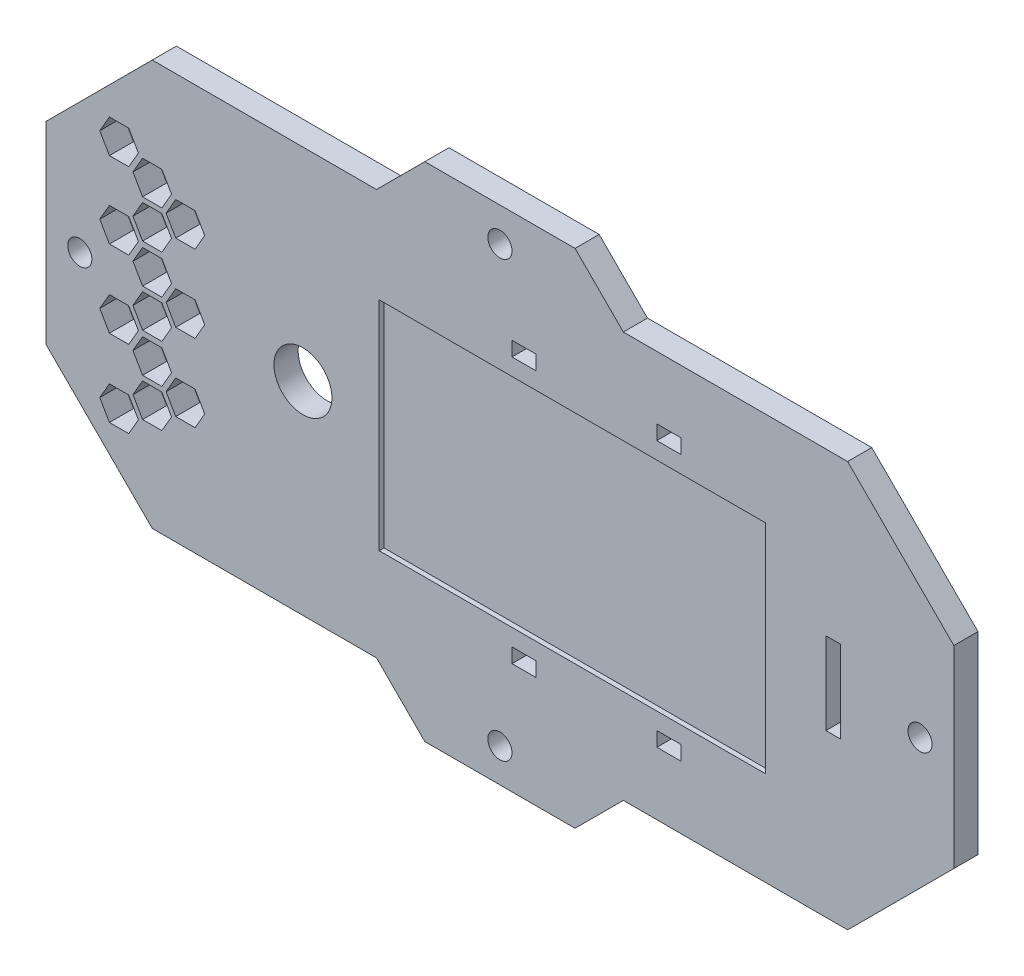
from build123d import *

# Parameters (mm, degrees)
BASE_FLANGE1_OUTLINE_R  = 6
BASE_FLANGE1_DEPTH      = 5
SKETCH3_W               = 80
SKETCH3_H               = 45
CUT_EXTRUDE1_DEPTH      = 1
CROQUIS1_W              = 5
CROQUIS1_H              = 3
CORTAR_EXTRUIR1_DEPTH   = 108.540687679
CROQUIS2_R              = 2.5
CORTAR_EXTRUIR2_DEPTH   = 108.540687679
CROQUIS3_R              = 2.5
SALIENTE_EXTRUIR1_DEPTH = 5
CUT_EXTRUDE3_DEPTH      = 10
SKETCH9_W               = 3
SKETCH9_H               = 17
CUT_EXTRUDE4_DEPTH      = 10


# Read off the part's stored shape, not the designer's step: Base-Flange1
with BuildPart() as part:
    # Base-Flange1 outline → Base-Flange1 (new body)
    with BuildSketch(Plane(origin=(0, 0, 12.500000186), x_dir=(-1, 0, 0), z_dir=(0, 0, -1))):
        Polygon((-93.999996781, 19.999999553), (-93.999996781, -19.999999553), (-71.999996901, -41.999999434), (-25.556499138, -41.999999434), (-15.556500293, -52.000001073), (15.556500293, -52.000001073), (25.556499138, -41.999999434), (71.999996901, -41.999999434), (93.999996781, -19.999999553), (93.999996781, 19.999999553), (71.999996901, 41.999999434), (25.556499138, 41.999999434), (15.556500293, 52.000001073), (-15.556500293, 52.000001073), (-25.556499138, 41.999999434), (-71.999996901, 41.999999434), align=None)
        with Locations((40.791069868, 0)):
            Circle(BASE_FLANGE1_OUTLINE_R, mode=Mode.SUBTRACT)
    extrude(amount=BASE_FLANGE1_DEPTH)

    # Sketch3 → Cut-Extrude1 (cut)
    with BuildSketch(Plane.XY.offset(12.500000186)):
        with Locations((15, 0)):
            Rectangle(SKETCH3_W, SKETCH3_H)
    extrude(amount=-CUT_EXTRUDE1_DEPTH, mode=Mode.SUBTRACT)

    # Croquis1 → Cortar-Extruir1 (cut, through all)
    with BuildSketch(Plane.XY.offset(12.500000186)):
        with Locations((5, 27.5)):
            Rectangle(CROQUIS1_W, CROQUIS1_H)
        with Locations((35, 27.5)):
            Rectangle(CROQUIS1_W, CROQUIS1_H)
        with Locations((35, -27.5)):
            Rectangle(CROQUIS1_W, CROQUIS1_H)
        with Locations((5, -27.5)):
            Rectangle(CROQUIS1_W, CROQUIS1_H)
    extrude(amount=-CORTAR_EXTRUIR1_DEPTH, mode=Mode.SUBTRACT)

    # Croquis2 → Cortar-Extruir2 (cut, through all)
    with BuildSketch(Plane(origin=(0, 0, 7.500000186), x_dir=(-1, 0, 0), z_dir=(0, 0, -1))):
        with Locations((-86.999996781, 0)):
            Circle(CROQUIS2_R)
        with Locations(Location((86.999996781, 0, 0), (0, 0, 180))):
            Circle(CROQUIS2_R)
        with Locations((0, 45.000001073)):
            Circle(CROQUIS2_R)
        with Locations(Location((0, -45.000001073, 0), (0, 0, 180))):
            Circle(CROQUIS2_R)
    extrude(amount=-CORTAR_EXTRUIR2_DEPTH, mode=Mode.SUBTRACT)

    # Croquis3 → Saliente-Extruir1 (add)
    with BuildSketch(Plane(origin=(0, 0, 7.500000186), x_dir=(-1, 0, 0), z_dir=(0, 0, -1))):
        with Locations((-50.999996781, 0)):
            Circle(CROQUIS3_R)
        with Locations((-68.999996781, 20)):
            Circle(CROQUIS3_R)
        with Locations((-68.999996781, -20)):
            Circle(CROQUIS3_R)
    extrude(amount=SALIENTE_EXTRUIR1_DEPTH)

    # Sketch8 → Cut-Extrude3 (cut)
    with BuildSketch(Plane.XY.offset(12.500000186)):
        Polygon((-67.999996901, -19.999999553), (-69.999996901, -16.535897938), (-73.999996901, -16.535897938), (-75.999996901, -19.999999553), (-73.999996901, -23.464101168), (-69.999996901, -23.464101168), align=None)
        Polygon((-69.999996901, -8.607694708), (-67.999996901, -12.071796323), (-69.999996901, -15.535897938), (-73.999996901, -15.535897938), (-75.999996901, -12.071796323), (-73.999996901, -8.607694708), align=None)
        Polygon((-63.133971497, -19.499999553), (-67.133971497, -19.499999553), (-69.133971497, -16.035897938), (-67.133971497, -12.571796323), (-63.133971497, -12.571796323), (-61.133971497, -16.035897938), align=None)
        Polygon((-67.999996901, -3.999999553), (-69.999996901, -0.535897938), (-73.999996901, -0.535897938), (-75.999996901, -3.999999553), (-73.999996901, -7.464101168), (-69.999996901, -7.464101168), align=None)
        Polygon((-76.866022304, -27.428202783), (-80.866022304, -27.428202783), (-82.866022304, -23.964101168), (-80.866022304, -20.499999553), (-76.866022304, -20.499999553), (-74.866022304, -23.964101168), align=None)
        Polygon((-69.999996901, 7.392305292), (-67.999996901, 3.928203677), (-69.999996901, 0.464102062), (-73.999996901, 0.464102062), (-75.999996901, 3.928203677), (-73.999996901, 7.392305292), align=None)
        Polygon((-63.133971497, -3.499999553), (-67.133971497, -3.499999553), (-69.133971497, -0.035897938), (-67.133971497, 3.428203677), (-63.133971497, 3.428203677), (-61.133971497, -0.035897938), align=None)
        Polygon((-76.866022304, -11.428202783), (-80.866022304, -11.428202783), (-82.866022304, -7.964101168), (-80.866022304, -4.499999553), (-76.866022304, -4.499999553), (-74.866022304, -7.964101168), align=None)
        Polygon((-67.999996901, 12.000000447), (-69.999996901, 15.464102062), (-73.999996901, 15.464102062), (-75.999996901, 12.000000447), (-73.999996901, 8.535898832), (-69.999996901, 8.535898832), align=None)
        Polygon((-69.999996901, 23.392305292), (-67.999996901, 19.928203677), (-69.999996901, 16.464102062), (-73.999996901, 16.464102062), (-75.999996901, 19.928203677), (-73.999996901, 23.392305292), align=None)
        Polygon((-63.133971497, 12.500000447), (-67.133971497, 12.500000447), (-69.133971497, 15.964102062), (-67.133971497, 19.428203677), (-63.133971497, 19.428203677), (-61.133971497, 15.964102062), align=None)
        Polygon((-76.866022304, 4.571797217), (-80.866022304, 4.571797217), (-82.866022304, 8.035898832), (-80.866022304, 11.500000447), (-76.866022304, 11.500000447), (-74.866022304, 8.035898832), align=None)
        Polygon((-74.866022304, 23.892305292), (-76.866022304, 27.356406908), (-80.866022304, 27.356406908), (-82.866022304, 23.892305292), (-80.866022304, 20.428203677), (-76.866022304, 20.428203677), align=None)
    extrude(amount=-CUT_EXTRUDE3_DEPTH, mode=Mode.SUBTRACT)

    # Sketch9 → Cut-Extrude4 (cut)
    with BuildSketch(Plane.XY.offset(12.500000186)):
        with Locations((68.999996781, 0)):
            Rectangle(SKETCH9_W, SKETCH9_H)
    extrude(amount=-CUT_EXTRUDE4_DEPTH, mode=Mode.SUBTRACT)


solid = part.part
